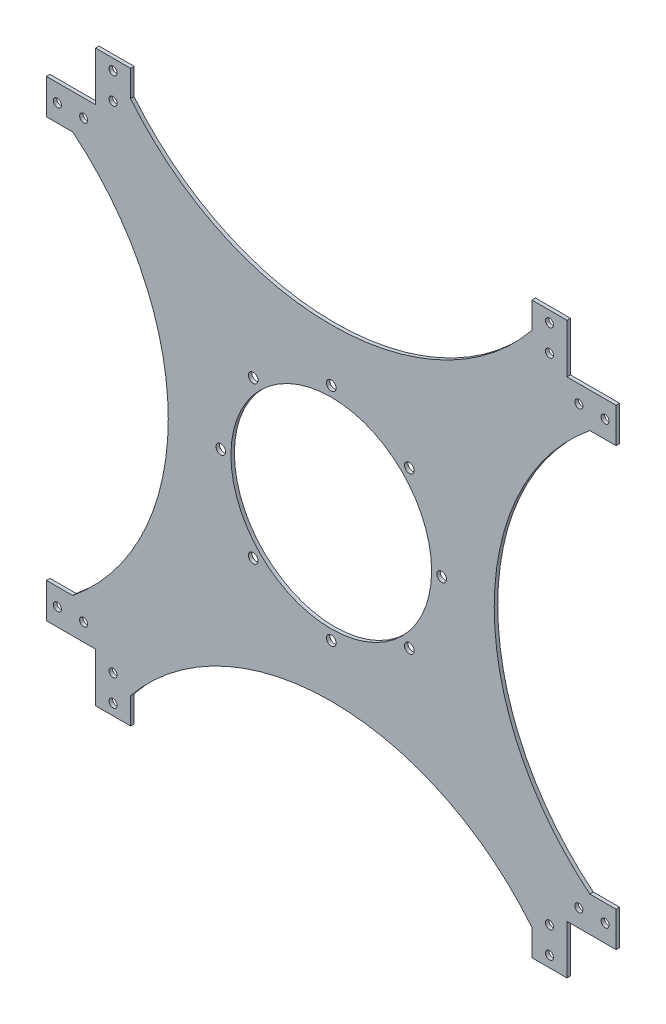
from build123d import *

# Parameters (mm, degrees)
SKETCH1_R          = 114.5
BASE_FLANGE1_DEPTH = 4
SKETCH2_R          = 4.6
EXTRUDE1_DEPTH     = 4
SKETCH3_R          = 5.5
EXTRUDE2_DEPTH     = 4
CIRPATTERN1_COUNT  = 8


# Sheet-metal steps are written as plain solids
with BuildPart() as part:
    # Sketch1 → Base-Flange1 (new body)
    with BuildSketch(Plane.XY):
        with BuildLine():
            Line((269, 269), (269, 325))
            Line((269, 325), (229, 325))
            Line((229, 325), (229, 295))
            ThreePointArc((229, 295), (0, 185.967739138), (-229, 295))
            Line((-229, 295), (-229, 325))
            Line((-229, 325), (-269, 325))
            Line((-269, 325), (-269, 269))
            Line((-269, 269), (-325, 269))
            Line((-325, 269), (-325, 229))
            Line((-325, 229), (-295, 229))
            ThreePointArc((-295, 229), (-185.967739138, 0), (-295, -229))
            Line((-295, -229), (-325, -229))
            Line((-325, -229), (-325, -269))
            Line((-325, -269), (-269, -269))
            Line((-269, -269), (-269, -325))
            Line((-269, -325), (-229, -325))
            Line((-229, -325), (-229, -295))
            ThreePointArc((-229, -295), (0, -185.967739138), (229, -295))
            Line((229, -295), (229, -325))
            Line((229, -325), (269, -325))
            Line((269, -325), (269, -269))
            Line((269, -269), (325, -269))
            Line((325, -269), (325, -229))
            Line((325, -229), (295, -229))
            ThreePointArc((295, -229), (185.967739138, 0), (295, 229))
            Line((295, 229), (325, 229))
            Line((325, 229), (325, 269))
            Line((325, 269), (269, 269))
        make_face()
        Circle(SKETCH1_R, mode=Mode.SUBTRACT)
    extrude(amount=BASE_FLANGE1_DEPTH)

    # Sketch2 → Extrude1 (cut)
    with BuildSketch(Plane.XY.offset(4)):
        with Locations((249, 312.5)):
            Circle(SKETCH2_R)
        with Locations((249, 282.5)):
            Circle(SKETCH2_R)
        with Locations((282.5, 249)):
            Circle(SKETCH2_R)
        with Locations((312.5, 249)):
            Circle(SKETCH2_R)
        with Locations(Location((312.5, -249, 0), (0, 0, 180))):
            Circle(SKETCH2_R)
        with Locations(Location((282.5, -249, 0), (0, 0, 180))):
            Circle(SKETCH2_R)
        with Locations(Location((249, -282.5, 0), (0, 0, 180))):
            Circle(SKETCH2_R)
        with Locations(Location((249, -312.5, 0), (0, 0, 180))):
            Circle(SKETCH2_R)
        with Locations((-249, -312.5)):
            Circle(SKETCH2_R)
        with Locations((-249, -282.5)):
            Circle(SKETCH2_R)
        with Locations((-282.5, -249)):
            Circle(SKETCH2_R)
        with Locations((-312.5, -249)):
            Circle(SKETCH2_R)
        with Locations(Location((-312.5, 249, 0), (0, 0, 180))):
            Circle(SKETCH2_R)
        with Locations(Location((-282.5, 249, 0), (0, 0, 180))):
            Circle(SKETCH2_R)
        with Locations(Location((-249, 282.5, 0), (0, 0, 180))):
            Circle(SKETCH2_R)
        with Locations(Location((-249, 312.5, 0), (0, 0, 180))):
            Circle(SKETCH2_R)
    extrude(amount=-EXTRUDE1_DEPTH, mode=Mode.SUBTRACT)

    # Sketch3 → Extrude2 (cut)
    with BuildSketch(Plane.XY.offset(4)):
        with Locations((0, 126)):
            Circle(SKETCH3_R)
    extrude2 = extrude(amount=-EXTRUDE2_DEPTH, mode=Mode.SUBTRACT)

    # CirPattern1: Extrude2 ×8 about axis
    cirpattern1_axis = Axis((0, 0, 0), (0, 0, 1))
    for i in range(1, CIRPATTERN1_COUNT):
        add(extrude2.rotate(cirpattern1_axis, i * 360 / CIRPATTERN1_COUNT), mode=Mode.SUBTRACT)


solid = part.part
